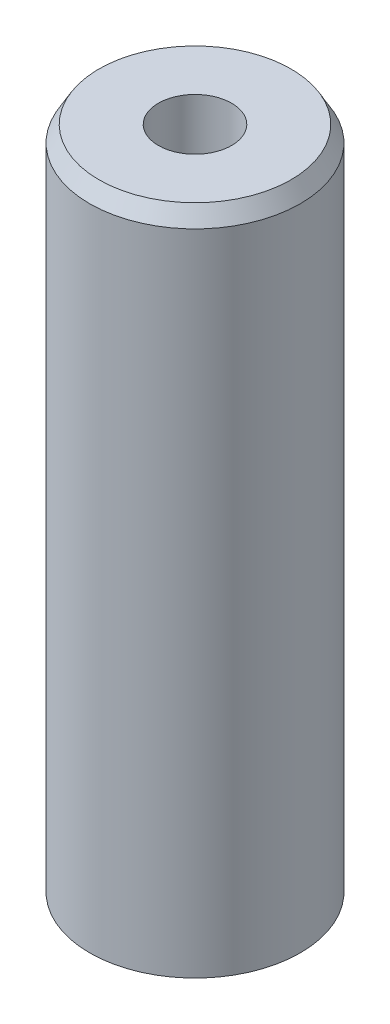
from build123d import *
from OCP.BRepFilletAPI import BRepFilletAPI_MakeChamfer

# Parameters (mm, degrees)
SKETCH1_R           = 7.5
BOSS_EXTRUDE1_DEPTH = 48.007590394
SKETCH2_R           = 2.609879689
CUT_EXTRUDE1_DEPTH  = 50.165320455
CHAMFER1_SIZE       = 1.145963896
CHAMFER1_SIZE2      = 0.661622564


with BuildPart() as part:
    # Sketch1 → Boss-Extrude1 (new body)
    with BuildSketch(Plane(origin=(0, 0, 0), x_dir=(1, 0, 0), z_dir=(0, 1, 0))):
        Circle(SKETCH1_R)
    extrude(amount=BOSS_EXTRUDE1_DEPTH)

    # Sketch2 → Cut-Extrude1 (cut, through all)
    with BuildSketch(Plane(origin=(0, 0, 0), x_dir=(1, 0, 0), z_dir=(0, 1, 0))):
        Circle(SKETCH2_R)
    extrude(amount=CUT_EXTRUDE1_DEPTH, mode=Mode.SUBTRACT)

    # Chamfer1: one chamfer whose edges measure the first distance from different faces: ONE call of the kernel's chamfer builder (chamfer() names one face for all edges)
    chamfer1_edges_1 = [part.edges().sort_by_distance(p)[0] for p in [
        (-7.5, 48.007590394, 0),
    ]]
    chamfer1_side_1 = [part.faces().sort_by_distance(p)[0] for p in [
        (-7.5, 24.003795197, 0),
    ]]
    chamfer1_edges_2 = [part.edges().sort_by_distance(p)[0] for p in [
        (-7.5, 0, 0),
    ]]
    chamfer1_side_2 = [part.faces().sort_by_distance(p)[0] for p in [
        (-7.287867966, 0, 0),
    ]]
    chamfer1 = BRepFilletAPI_MakeChamfer(part.part.solid().wrapped)
    for e in chamfer1_edges_1:
        chamfer1.Add(CHAMFER1_SIZE, CHAMFER1_SIZE2, e.wrapped, chamfer1_side_1[0].wrapped)  # the first distance lies on this face
    for e in chamfer1_edges_2:
        chamfer1.Add(CHAMFER1_SIZE, CHAMFER1_SIZE2, e.wrapped, chamfer1_side_2[0].wrapped)  # the first distance lies on this face
    add(Compound.cast(chamfer1.Shape()), mode=Mode.REPLACE)


solid = part.part
